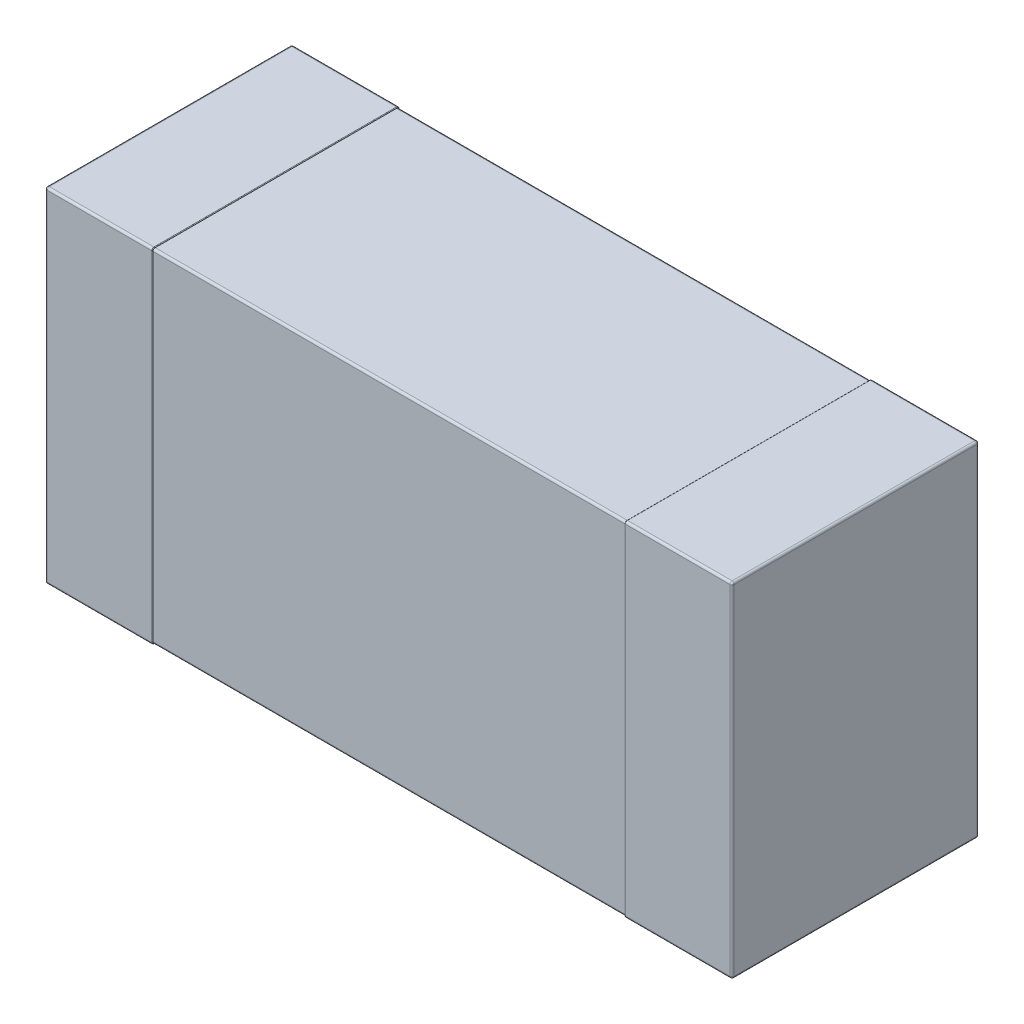
from build123d import *

# Parameters (mm, degrees)
SKETCH1_W                           = 3.2
SKETCH1_H                           = 1.6
ALL_BODY_DEPTH                      = 1.15
CUT_OUT_THE_BODY_FOR_PIN_DEPTH      = 1.1
CUT_OUT_THE_BODY_FOR_PIN_DEPTH_BACK = 1.1
SKETCH2_OUTSIDE_W                   = 3.902
SKETCH2_OUTSIDE_H                   = 4.352
SKETCH2_OUTSIDE_W_2                 = 1.144
SKETCH2_OUTSIDE_H_2                 = 1.594
BODY_FILLET_R                       = 0.01
PIN_FILLET_A_R                      = 0.01
PIN_FILLET_B_R                      = 0.003


with BuildPart() as part:
    # Sketch1 → All body (new body)
    with BuildSketch(Plane.XY):
        Rectangle(SKETCH1_W, SKETCH1_H)
    extrude(amount=ALL_BODY_DEPTH)

    # Sketch2 outside → Cut out the body for pin (cut, two sides: drawn at the far end of the back side and taken through both)
    with BuildSketch(Plane(origin=(0, 0, 0), x_dir=(0, 0, -1), z_dir=(1, 0, 0)).offset(-CUT_OUT_THE_BODY_FOR_PIN_DEPTH_BACK)):
        with Locations((-0.575, 0)):
            Rectangle(SKETCH2_OUTSIDE_W, SKETCH2_OUTSIDE_H)
        with Locations((-0.575, 0)):
            Rectangle(SKETCH2_OUTSIDE_W_2, SKETCH2_OUTSIDE_H_2, mode=Mode.SUBTRACT)
    extrude(amount=CUT_OUT_THE_BODY_FOR_PIN_DEPTH + CUT_OUT_THE_BODY_FOR_PIN_DEPTH_BACK, mode=Mode.SUBTRACT)

    # Body fillet
    body_fillet_edges = [part.edges().sort_by_distance(p)[0] for p in [
        (0, 0.797, 0.003),
        (0, 0.797, 1.147),
        (0, -0.797, 1.147),
        (0, -0.797, 0.003),
    ]]
    fillet(body_fillet_edges, radius=BODY_FILLET_R)

    # Pin fillet a
    pin_fillet_a_edges = [part.edges().sort_by_distance(p)[0] for p in [
        (1.6, 0, 1.15),
        (-1.35, 0.8, 0),
        (1.35, -0.8, 0),
        (1.35, -0.8, 1.15),
        (-1.35, 0.8, 1.15),
        (1.35, 0.8, 1.15),
        (-1.6, 0, 1.15),
        (1.35, 0.8, 0),
        (1.6, 0, 0),
        (-1.35, -0.8, 0),
        (-1.6, 0, 0),
        (-1.6, 0.8, 0.575),
        (1.6, 0.8, 0.575),
        (1.6, -0.8, 0.575),
        (-1.6, -0.8, 0.575),
        (-1.35, -0.8, 1.15),
    ]]
    fillet(pin_fillet_a_edges, radius=PIN_FILLET_A_R)

    # Pin fillet b
    pin_fillet_b_edges = [part.edges().sort_by_distance(p)[0] for p in [
        (1.1, -0.8, 0.575),
        (1.1, 0, 1.15),
        (1.1, 0.8, 0.575),
        (1.1, 0, 0),
        (-1.1, 0.8, 0.575),
        (-1.1, 0, 1.15),
        (-1.1, -0.8, 0.575),
        (-1.1, 0, 0),
        (1.1, 0.797071068, 0.002928932),
        (1.1, -0.797071068, 0.002928932),
        (1.1, -0.797071068, 1.147071068),
        (1.1, 0.797071068, 1.147071068),
        (-1.1, -0.797071068, 1.147071068),
        (-1.1, 0.797071068, 1.147071068),
        (-1.1, -0.797071068, 0.002928932),
        (-1.1, 0.797071068, 0.002928932),
    ]]
    fillet(pin_fillet_b_edges, radius=PIN_FILLET_B_R - 0.0001)  # a hair under: the kernel refuses the full size


solid = part.part
